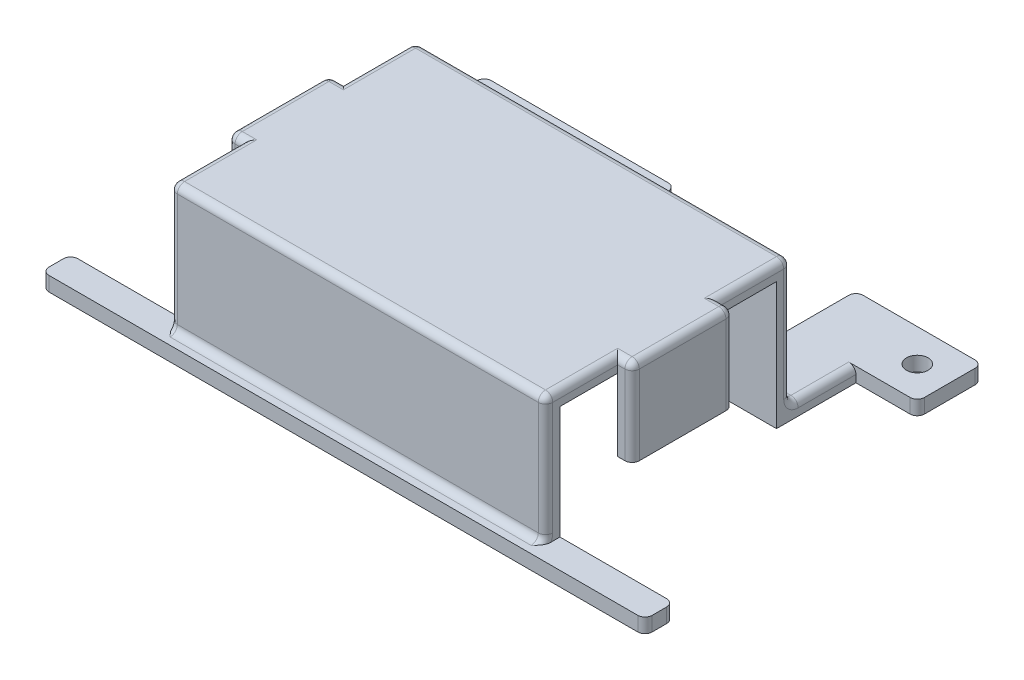
from build123d import *

# Parameters (mm, degrees)
SKETCH1_W            = 52
SKETCH1_H            = 34
BOSS_EXTRUDE1_DEPTH  = 19.65
SKETCH2_W            = 52
SKETCH2_H            = 30
CUT_EXTRUDE1_DEPTH   = 17.65
SKETCH3_W            = 9
SKETCH3_H            = 2
SKETCH3_W_2          = 18
BOSS_EXTRUDE2_DEPTH  = 18
SKETCH4_W            = 18
SKETCH4_H            = 2
BOSS_EXTRUDE3_DEPTH  = 8.5
SKETCH5_W            = 18
SKETCH5_H            = 2
BOSS_EXTRUDE4_DEPTH  = 8.5
SKETCH6_R            = 1.5
CUT_EXTRUDE2_DEPTH   = 82.705400678
SKETCH7_W            = 52
SKETCH7_H            = 2
BOSS_EXTRUDE5_DEPTH  = 2
SKETCH8_W            = 4
SKETCH8_H            = 2
BOSS_EXTRUDE6_DEPTH  = 15.78
SKETCH9_W            = 4
SKETCH9_H            = 2
BOSS_EXTRUDE7_DEPTH  = 15.78
SKETCH11_W           = 11
SKETCH11_H           = 17.65
CUT_EXTRUDE3_DEPTH   = 18
SKETCH12_W           = 9
SKETCH12_H           = 2
CUT_EXTRUDE4_DEPTH   = 8.5
SKETCH14_W           = 14
SKETCH14_H           = 2
BOSS_EXTRUDE8_DEPTH  = 2
SKETCH15_W           = 14
SKETCH15_H           = 2
BOSS_EXTRUDE9_DEPTH  = 2
SKETCH16_W           = 2
SKETCH16_H           = 14
BOSS_EXTRUDE10_DEPTH = 10
FILLET1_R            = 1
FILLET2_R            = 1
FILLET3_R            = 1
FILLET4_R            = 1


with BuildPart() as part:
    # Sketch1 → Boss-Extrude1 (new body)
    with BuildSketch(Plane(origin=(0, 0, 0), x_dir=(1, 0, 0), z_dir=(0, 1, 0))):
        with Locations((26, 17)):
            Rectangle(SKETCH1_W, SKETCH1_H)
    extrude(amount=BOSS_EXTRUDE1_DEPTH)

    # Sketch2 → Cut-Extrude1 (cut)
    with BuildSketch(Plane(origin=(0, 0, 0), x_dir=(-1, 0, 0), z_dir=(0, -1, 0))):
        with Locations((-26, 17)):
            Rectangle(SKETCH2_W, SKETCH2_H)
    extrude(amount=-CUT_EXTRUDE1_DEPTH, mode=Mode.SUBTRACT)

    # Sketch3 → Boss-Extrude2 (add)
    with BuildSketch(Plane(origin=(0, 0, -34), x_dir=(-1, 0, 0), z_dir=(0, 0, -1))):
        with Locations((-47.5, 1)):
            Rectangle(SKETCH3_W, SKETCH3_H)
        with Locations((-9, 1)):
            Rectangle(SKETCH3_W_2, SKETCH3_H)
    extrude(amount=BOSS_EXTRUDE2_DEPTH)

    # Sketch4 → Boss-Extrude3 (add)
    with BuildSketch(Plane(origin=(52, 0, 0), x_dir=(0, 0, -1), z_dir=(1, 0, 0))):
        with Locations((43, 1)):
            Rectangle(SKETCH4_W, SKETCH4_H)
    extrude(amount=BOSS_EXTRUDE3_DEPTH)

    # Sketch5 → Boss-Extrude4 (add)
    with BuildSketch(Plane.ZY):
        with Locations((-43, 1)):
            Rectangle(SKETCH5_W, SKETCH5_H)
    extrude(amount=BOSS_EXTRUDE4_DEPTH)

    # Sketch6 → Cut-Extrude2 (cut, through all)
    with BuildSketch(Plane(origin=(0, 2, 0), x_dir=(1, 0, 0), z_dir=(0, 1, 0))):
        with Locations(Location((56, 47.5, 0), (0, 0, 270))):
            Circle(SKETCH6_R)
        with Locations(Location((-4, 47.5, 0), (0, 0, 270))):
            Circle(SKETCH6_R)
    extrude(amount=-CUT_EXTRUDE2_DEPTH, mode=Mode.SUBTRACT)

    # Sketch7 → Boss-Extrude5 (add)
    with BuildSketch(Plane.XY):
        with Locations((26, 1)):
            Rectangle(SKETCH7_W, SKETCH7_H)
    extrude(amount=BOSS_EXTRUDE5_DEPTH)

    # Sketch8 → Boss-Extrude6 (add)
    with BuildSketch(Plane.ZY):
        with Locations((0, 1)):
            Rectangle(SKETCH8_W, SKETCH8_H)
    extrude(amount=BOSS_EXTRUDE6_DEPTH)

    # Sketch9 → Boss-Extrude7 (add)
    with BuildSketch(Plane(origin=(52, 0, 0), x_dir=(0, 0, -1), z_dir=(1, 0, 0))):
        with Locations((0, 1)):
            Rectangle(SKETCH9_W, SKETCH9_H)
    extrude(amount=BOSS_EXTRUDE7_DEPTH)

    # Sketch11 → Cut-Extrude3 (cut)
    with BuildSketch(Plane.ZY.offset(8.5)):
        with Locations((-37.5, 8.825)):
            Rectangle(SKETCH11_W, SKETCH11_H)
    extrude(amount=-CUT_EXTRUDE3_DEPTH, mode=Mode.SUBTRACT)

    # Sketch12 → Cut-Extrude4 (cut)
    with BuildSketch(Plane(origin=(60.5, 0, 0), x_dir=(0, 0, -1), z_dir=(1, 0, 0))):
        with Locations((38.5, 1)):
            Rectangle(SKETCH12_W, SKETCH12_H)
    extrude(amount=-CUT_EXTRUDE4_DEPTH, mode=Mode.SUBTRACT)

    # Sketch14 → Boss-Extrude8 (add)
    with BuildSketch(Plane.ZY):
        with Locations((-17, 18.65)):
            Rectangle(SKETCH14_W, SKETCH14_H)
    extrude(amount=BOSS_EXTRUDE8_DEPTH)

    # Sketch15 → Boss-Extrude9 (add)
    with BuildSketch(Plane(origin=(52, 0, 0), x_dir=(0, 0, -1), z_dir=(1, 0, 0))):
        with Locations((17, 18.65)):
            Rectangle(SKETCH15_W, SKETCH15_H)
    extrude(amount=BOSS_EXTRUDE9_DEPTH)

    # Sketch16 → Boss-Extrude10 (add)
    with BuildSketch(Plane(origin=(0, 17.65, 0), x_dir=(-1, 0, 0), z_dir=(0, -1, 0))):
        with Locations((1, 17)):
            Rectangle(SKETCH16_W, SKETCH16_H)
        with Locations((-53, 17)):
            Rectangle(SKETCH16_W, SKETCH16_H)
    extrude(amount=BOSS_EXTRUDE10_DEPTH)

    # Fillet1
    fillet1_edges = [part.edges().sort_by_distance(p)[0] for p in [
        (13.75, 2, -34),
        (26, 19.65, -34),
        (43, 1, -34),
        (47.5, 2, -34),
        (18, 1, -34),
        (26, 19.65, 0),
        (26, 2, 0),
    ]]
    fillet(fillet1_edges, radius=FILLET1_R)

    # Fillet2
    # the kernel refuses this fillet: 1 mm, written as the material it takes off along each edge
    with BuildSketch(Plane(origin=(9.5, 2, -35), x_dir=(0, -1, 0), z_dir=(0, 0, -1))) as fillet2_piece_1:
        with BuildLine():
            CenterArc((FILLET2_R, -FILLET2_R), FILLET2_R, 90, 90)
            Line((0, -FILLET2_R), (0, 0))
            Line((0, 0), (FILLET2_R, 0))
        make_face()
    extrude(amount=8, mode=Mode.SUBTRACT)
    with BuildSketch(Plane(origin=(9.5, 3, -35), x_dir=(0, 0, 1), z_dir=(0, 1, 0))) as fillet2_piece_2:
        with BuildLine():
            CenterArc((1 + FILLET2_R, FILLET2_R), FILLET2_R, 180, 90)
            Line((1, FILLET2_R), (1, 0))
            Line((1, 0), (1 + FILLET2_R, 0))
        make_face()
    revolve(axis=Axis((9.5, 3, -35), (1, 0, 0)), revolution_arc=90, mode=Mode.SUBTRACT)
    with BuildSketch(Plane(origin=(0, 15.15, -34), x_dir=(0, 0, 1), z_dir=(0, 1, 0))) as fillet2_piece_3:
        with BuildLine():
            CenterArc((FILLET2_R, FILLET2_R), FILLET2_R, 180, 90)
            Line((0, FILLET2_R), (0, 0))
            Line((0, 0), (FILLET2_R, 0))
        make_face()
    extrude(amount=3.5, mode=Mode.SUBTRACT)
    with BuildSketch(Plane(origin=(0, 18.65, -33), x_dir=(0, 0, -1), z_dir=(0, -1, 0))) as fillet2_piece_4:
        with BuildLine():
            CenterArc((1 - FILLET2_R, FILLET2_R), FILLET2_R, 270, 90)
            Line((1, FILLET2_R), (1, 0))
            Line((1, 0), (1 - FILLET2_R, 0))
        make_face()
    revolve(axis=Axis((0, 18.65, -33), (1, 0, 0)), revolution_arc=90, mode=Mode.SUBTRACT)
    with BuildSketch(Plane(origin=(0, 3, 1), x_dir=(0, 0, -1), z_dir=(0, 1, 0))) as fillet2_piece_5_section:
        with BuildLine():
            CenterArc((1 + FILLET2_R, -FILLET2_R), FILLET2_R, 90, 90)
            Line((1, -FILLET2_R), (1, 0))
            Line((1, 0), (1 + FILLET2_R, 0))
        make_face()
    fillet2_piece_5 = revolve(axis=Axis((0, 3, 1), (-1, 0, 0)), revolution_arc=233.296989237, mode=Mode.PRIVATE)
    fillet2_piece_5 = split(fillet2_piece_5, bisect_by=Plane(origin=(0, 2, 1), z_dir=(0, 1, 0)), keep=Keep.TOP, mode=Mode.PRIVATE)
    add(fillet2_piece_5, mode=Mode.SUBTRACT)
    with BuildSketch(Plane(origin=(0, 3, 0), x_dir=(1, 0, 0), z_dir=(0, 1, 0)), Plane(origin=(52, 3, -34), x_dir=(-1, 0, 0), z_dir=(0, 1, 0))) as fillet2_piece_6:
        with BuildLine():
            CenterArc((FILLET2_R, FILLET2_R), FILLET2_R, 180, 90)
            Line((0, FILLET2_R), (0, 0))
            Line((0, 0), (FILLET2_R, 0))
        make_face()
    extrude(amount=15.65, mode=Mode.SUBTRACT)
    with BuildSketch(Plane(origin=(0, 18.65, -1), x_dir=(0, 0, 1), z_dir=(0, -1, 0))) as fillet2_piece_7:
        with BuildLine():
            CenterArc((1 - FILLET2_R, -FILLET2_R), FILLET2_R, 0, 90)
            Line((1, -FILLET2_R), (1, 0))
            Line((1, 0), (1 - FILLET2_R, 0))
        make_face()
    revolve(axis=Axis((0, 18.65, -1), (-1, 0, 0)), revolution_arc=90, mode=Mode.SUBTRACT)
    with BuildSketch(Plane(origin=(52, 2, -43), x_dir=(-1, 0, 0), z_dir=(0, 0, 1))) as fillet2_piece_8:
        with BuildLine():
            CenterArc((FILLET2_R, FILLET2_R), FILLET2_R, 180, 90)
            Line((0, FILLET2_R), (0, 0))
            Line((0, 0), (FILLET2_R, 0))
        make_face()
    extrude(amount=8, mode=Mode.SUBTRACT)
    with BuildSketch(Plane(origin=(52, 3, -35), x_dir=(0, 0, 1), z_dir=(0, 1, 0))) as fillet2_piece_9:
        with BuildLine():
            CenterArc((1 + FILLET2_R, -FILLET2_R), FILLET2_R, 90, 90)
            Line((1 + FILLET2_R, 0), (1, 0))
            Line((1, 0), (1, -FILLET2_R))
        make_face()
    revolve(axis=Axis((52, 3, -35), (1, 0, 0)), revolution_arc=90, mode=Mode.SUBTRACT)
    with BuildSketch(Plane(origin=(52, 18.65, -33), x_dir=(0, 0, -1), z_dir=(0, -1, 0))) as fillet2_piece_10:
        with BuildLine():
            CenterArc((1 - FILLET2_R, -FILLET2_R), FILLET2_R, 0, 90)
            Line((1 - FILLET2_R, 0), (1, 0))
            Line((1, 0), (1, -FILLET2_R))
        make_face()
    revolve(axis=Axis((52, 18.65, -33), (1, 0, 0)), revolution_arc=90, mode=Mode.SUBTRACT)
    with BuildSketch(Plane(origin=(52, 3, 1), x_dir=(0, 0, -1), z_dir=(0, 1, 0))) as fillet2_piece_11_section:
        with BuildLine():
            CenterArc((1 + FILLET2_R, FILLET2_R), FILLET2_R, 180, 90)
            Line((1 + FILLET2_R, 0), (1, 0))
            Line((1, 0), (1, FILLET2_R))
        make_face()
    fillet2_piece_11 = revolve(axis=Axis((52, 3, 1), (-1, 0, 0)), revolution_arc=233.296989237, mode=Mode.PRIVATE)
    fillet2_piece_11 = split(fillet2_piece_11, bisect_by=Plane(origin=(52, 2, 1), z_dir=(0, 1, 0)), keep=Keep.TOP, mode=Mode.PRIVATE)
    add(fillet2_piece_11, mode=Mode.SUBTRACT)
    with BuildSketch(Plane(origin=(52, 3, 0), x_dir=(-1, 0, 0), z_dir=(0, 1, 0))) as fillet2_piece_12:
        with BuildLine():
            CenterArc((FILLET2_R, -FILLET2_R), FILLET2_R, 90, 90)
            Line((0, -FILLET2_R), (0, 0))
            Line((0, 0), (FILLET2_R, 0))
        make_face()
    extrude(amount=15.65, mode=Mode.SUBTRACT)
    with BuildSketch(Plane(origin=(52, 18.65, -1), x_dir=(0, 0, 1), z_dir=(0, -1, 0))) as fillet2_piece_13:
        with BuildLine():
            CenterArc((1 - FILLET2_R, FILLET2_R), FILLET2_R, 270, 90)
            Line((1 - FILLET2_R, 0), (1, 0))
            Line((1, 0), (1, FILLET2_R))
        make_face()
    revolve(axis=Axis((52, 18.65, -1), (-1, 0, 0)), revolution_arc=90, mode=Mode.SUBTRACT)
    with BuildSketch(Plane(origin=(9.5, 3, -34), x_dir=(1, 0, 0), z_dir=(0, 1, 0))) as fillet2_piece_14:
        with BuildLine():
            CenterArc((FILLET2_R, -FILLET2_R), FILLET2_R, 90, 90)
            Line((0, -FILLET2_R), (0, 0))
            Line((0, 0), (FILLET2_R, 0))
        make_face()
    extrude(amount=14.65, mode=Mode.SUBTRACT)
    with BuildSketch(Plane(origin=(0, 19.65, -24), x_dir=(0, 0, 1), z_dir=(-1, 0, 0)), Plane(origin=(52, 19.65, -10), x_dir=(0, 0, -1), z_dir=(1, 0, 0))) as fillet2_piece_15:
        with BuildLine():
            CenterArc((FILLET2_R, -FILLET2_R), FILLET2_R, 90, 90)
            Line((0, -FILLET2_R), (0, 0))
            Line((0, 0), (FILLET2_R, 0))
        make_face()
    extrude(amount=4.5, mode=Mode.SUBTRACT)
    with BuildSketch(Plane(origin=(0, 19.65, -33), x_dir=(1, 0, 0), z_dir=(0, 0, 1)), Plane(origin=(52, 19.65, -24), x_dir=(-1, 0, 0), z_dir=(0, 0, -1)), Plane(origin=(52, 19.65, -1), x_dir=(-1, 0, 0), z_dir=(0, 0, -1))) as fillet2_piece_16:
        with BuildLine():
            CenterArc((FILLET2_R, -FILLET2_R), FILLET2_R, 90, 90)
            Line((0, -FILLET2_R), (0, 0))
            Line((0, 0), (FILLET2_R, 0))
        make_face()
    extrude(amount=9, mode=Mode.SUBTRACT)
    with BuildSketch(Plane(origin=(0, 19.65, -10), x_dir=(0, 0, -1), z_dir=(-1, 0, 0)), Plane(origin=(52, 19.65, -24), x_dir=(0, 0, 1), z_dir=(1, 0, 0))) as fillet2_piece_17:
        with BuildLine():
            CenterArc((FILLET2_R, FILLET2_R), FILLET2_R, 180, 90)
            Line((0, FILLET2_R), (0, 0))
            Line((0, 0), (FILLET2_R, 0))
        make_face()
    extrude(amount=4.5, mode=Mode.SUBTRACT)
    with BuildSketch(Plane(origin=(0, 19.65, -10), x_dir=(0, -1, 0), z_dir=(0, 0, 1))) as fillet2_piece_18:
        with BuildLine():
            CenterArc((FILLET2_R, FILLET2_R), FILLET2_R, 180, 90)
            Line((0, FILLET2_R), (0, 0))
            Line((0, 0), (FILLET2_R, 0))
        make_face()
    extrude(amount=9, mode=Mode.SUBTRACT)
    with BuildSketch(Plane(origin=(2.5, 19.65, -24), x_dir=(0, 0, 1), z_dir=(-1, 0, 0))) as fillet2_piece_19a_section:
        with BuildLine():
            CenterArc((FILLET2_R, -FILLET2_R), FILLET2_R, 90, 90)
            Line((0, -FILLET2_R), (0, 0))
            Line((0, 0), (FILLET2_R, 0))
        make_face()
    fillet2_piece_19a = extrude(amount=4.5, mode=Mode.PRIVATE)
    fillet2_piece_19a = split(fillet2_piece_19a, bisect_by=Plane(origin=(0, 19.65, -24), z_dir=(1, 0, 0)), keep=Keep.TOP, mode=Mode.PRIVATE)
    with BuildSketch(Plane(origin=(0, 19.65, -33), x_dir=(1, 0, 0), z_dir=(0, 0, 1))) as fillet2_piece_19b_section:
        with BuildLine():
            CenterArc((FILLET2_R, -FILLET2_R), FILLET2_R, 90, 90)
            Line((0, -FILLET2_R), (0, 0))
            Line((0, 0), (FILLET2_R, 0))
        make_face()
    fillet2_piece_19b = extrude(amount=11.5, mode=Mode.PRIVATE)
    fillet2_piece_19b = split(fillet2_piece_19b, bisect_by=Plane(origin=(0, 19.65, -24), z_dir=(0, 0, 1)), keep=Keep.TOP, mode=Mode.PRIVATE)
    fillet2_piece_19 = fillet2_piece_19a & fillet2_piece_19b
    add(fillet2_piece_19, mode=Mode.SUBTRACT)
    with BuildSketch(Plane(origin=(0, 19.65, -12.5), x_dir=(0, -1, 0), z_dir=(0, 0, 1))) as fillet2_piece_20a_section:
        with BuildLine():
            CenterArc((FILLET2_R, FILLET2_R), FILLET2_R, 180, 90)
            Line((0, FILLET2_R), (0, 0))
            Line((0, 0), (FILLET2_R, 0))
        make_face()
    fillet2_piece_20a = extrude(amount=11.5, mode=Mode.PRIVATE)
    fillet2_piece_20a = split(fillet2_piece_20a, bisect_by=Plane(origin=(0, 19.65, -10), z_dir=(0, 0, -1)), keep=Keep.TOP, mode=Mode.PRIVATE)
    with BuildSketch(Plane(origin=(2.5, 19.65, -10), x_dir=(0, 0, -1), z_dir=(-1, 0, 0))) as fillet2_piece_20b_section:
        with BuildLine():
            CenterArc((FILLET2_R, FILLET2_R), FILLET2_R, 180, 90)
            Line((0, FILLET2_R), (0, 0))
            Line((0, 0), (FILLET2_R, 0))
        make_face()
    fillet2_piece_20b = extrude(amount=4.5, mode=Mode.PRIVATE)
    fillet2_piece_20b = split(fillet2_piece_20b, bisect_by=Plane(origin=(0, 19.65, -10), z_dir=(1, 0, 0)), keep=Keep.TOP, mode=Mode.PRIVATE)
    fillet2_piece_20 = fillet2_piece_20a & fillet2_piece_20b
    add(fillet2_piece_20, mode=Mode.SUBTRACT)
    with BuildSketch(Plane(origin=(49.5, 19.65, -24), x_dir=(0, 0, 1), z_dir=(1, 0, 0))) as fillet2_piece_21a_section:
        with BuildLine():
            CenterArc((FILLET2_R, FILLET2_R), FILLET2_R, 180, 90)
            Line((0, FILLET2_R), (0, 0))
            Line((0, 0), (FILLET2_R, 0))
        make_face()
    fillet2_piece_21a = extrude(amount=4.5, mode=Mode.PRIVATE)
    fillet2_piece_21a = split(fillet2_piece_21a, bisect_by=Plane(origin=(52, 19.65, -24), z_dir=(-1, 0, 0)), keep=Keep.TOP, mode=Mode.PRIVATE)
    with BuildSketch(Plane(origin=(52, 19.65, -21.5), x_dir=(-1, 0, 0), z_dir=(0, 0, -1))) as fillet2_piece_21b_section:
        with BuildLine():
            CenterArc((FILLET2_R, -FILLET2_R), FILLET2_R, 90, 90)
            Line((0, -FILLET2_R), (0, 0))
            Line((0, 0), (FILLET2_R, 0))
        make_face()
    fillet2_piece_21b = extrude(amount=11.5, mode=Mode.PRIVATE)
    fillet2_piece_21b = split(fillet2_piece_21b, bisect_by=Plane(origin=(52, 19.65, -24), z_dir=(0, 0, 1)), keep=Keep.TOP, mode=Mode.PRIVATE)
    fillet2_piece_21 = fillet2_piece_21a & fillet2_piece_21b
    add(fillet2_piece_21, mode=Mode.SUBTRACT)
    with BuildSketch(Plane(origin=(52, 19.65, -1), x_dir=(-1, 0, 0), z_dir=(0, 0, -1))) as fillet2_piece_22a_section:
        with BuildLine():
            CenterArc((FILLET2_R, -FILLET2_R), FILLET2_R, 90, 90)
            Line((0, -FILLET2_R), (0, 0))
            Line((0, 0), (FILLET2_R, 0))
        make_face()
    fillet2_piece_22a = extrude(amount=11.5, mode=Mode.PRIVATE)
    fillet2_piece_22a = split(fillet2_piece_22a, bisect_by=Plane(origin=(52, 19.65, -10), z_dir=(0, 0, -1)), keep=Keep.TOP, mode=Mode.PRIVATE)
    with BuildSketch(Plane(origin=(49.5, 19.65, -10), x_dir=(0, 0, -1), z_dir=(1, 0, 0))) as fillet2_piece_22b_section:
        with BuildLine():
            CenterArc((FILLET2_R, -FILLET2_R), FILLET2_R, 90, 90)
            Line((0, -FILLET2_R), (0, 0))
            Line((0, 0), (FILLET2_R, 0))
        make_face()
    fillet2_piece_22b = extrude(amount=4.5, mode=Mode.PRIVATE)
    fillet2_piece_22b = split(fillet2_piece_22b, bisect_by=Plane(origin=(52, 19.65, -10), z_dir=(-1, 0, 0)), keep=Keep.TOP, mode=Mode.PRIVATE)
    fillet2_piece_22 = fillet2_piece_22a & fillet2_piece_22b
    add(fillet2_piece_22, mode=Mode.SUBTRACT)

    # Fillet3
    fillet3_edges = [part.edges().sort_by_distance(p)[0] for p in [
        (-2, 13.15, -10),
        (54, 13.15, -24),
        (-2, 13.15, -24),
        (-2, 19.65, -17),
        (54, 19.65, -17),
        (-2, 19.357106781, -10.292893219),
        (-2, 19.357106781, -23.707106781),
        (54, 13.15, -10),
        (54, 19.357106781, -10.292893219),
        (54, 19.357106781, -23.707106781),
    ]]
    fillet(fillet3_edges, radius=FILLET3_R)

    # Fillet4
    fillet4_edges = [part.edges().sort_by_distance(p)[0] for p in [
        (-15.78, 1, 2),
        (-15.78, 1, -2),
        (67.78, 1, 2),
        (67.78, 1, -2),
        (-8.5, 1, -43),
        (60.5, 1, -43),
        (43, 1, -52),
        (18, 1, -52),
        (60.5, 1, -52),
        (-8.5, 1, -52),
    ]]
    fillet(fillet4_edges, radius=FILLET4_R)


solid = part.part
